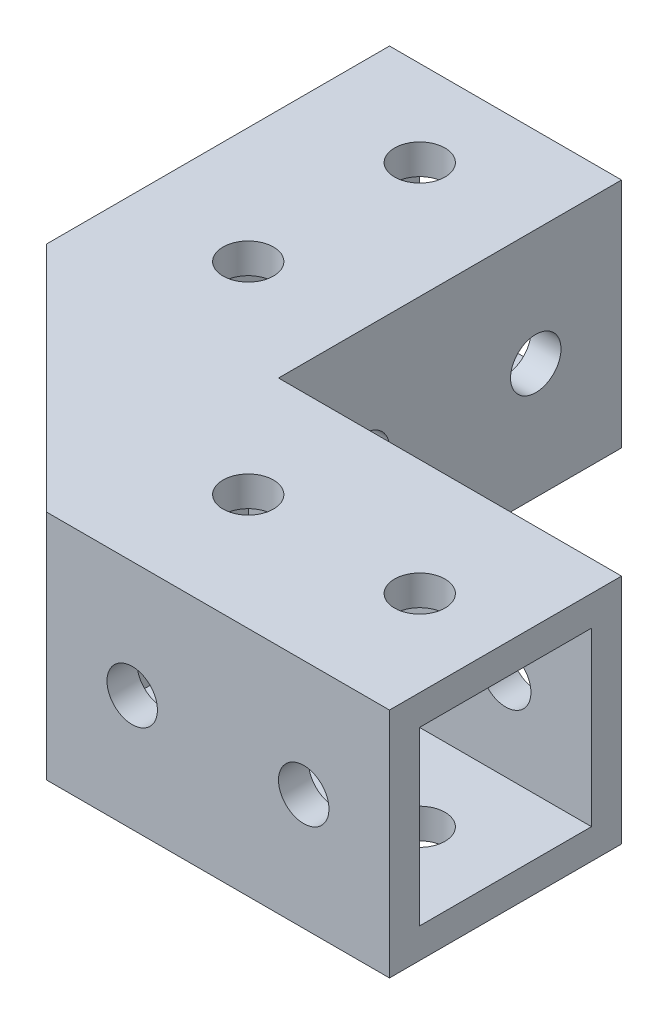
from build123d import *

# Parameters (mm, degrees)
SKETCH1_W           = 34
SKETCH1_H           = 23
SKETCH1_R           = 2.5
BOSS_EXTRUDE1_DEPTH = 23
SKETCH6_OUTSIDE_W   = 45.41
SKETCH6_OUTSIDE_H   = 34.41
SKETCH6_OUTSIDE_W_2 = 34
SKETCH6_OUTSIDE_H_2 = 23
SKETCH6_OUTSIDE_R   = 2.5
CUT_EXTRUDE10_DEPTH = 48.053161424
SKETCH7_OUTSIDE_W   = 34.41
SKETCH7_OUTSIDE_H   = 34.41
SKETCH7_OUTSIDE_W_2 = 23
SKETCH7_OUTSIDE_H_2 = 23
SKETCH7_OUTSIDE_W_3 = 17.04
SKETCH7_OUTSIDE_H_3 = 17.04
CUT_EXTRUDE11_DEPTH = 34
BOSS_EXTRUDE2_DEPTH = 23
SKETCH13_R          = 2.5
BOSS_EXTRUDE3_DEPTH = 4


with BuildPart() as part:
    # sketch1 → Boss-Extrude1 (new body)
    with BuildSketch(Plane(origin=(0, 0, 0), x_dir=(1, 0, 0), z_dir=(0, 1, 0))):
        with Locations((17, -11.5)):
            Rectangle(SKETCH1_W, SKETCH1_H)
        with Locations((8.5, -11.5)):
            Circle(SKETCH1_R, mode=Mode.SUBTRACT)
        with Locations((25.5, -11.5)):
            Circle(SKETCH1_R, mode=Mode.SUBTRACT)
    extrude(amount=BOSS_EXTRUDE1_DEPTH)

    # Sketch6 outside → Cut-Extrude10 (cut, through all)
    # profile 1 of 3: a face of its own
    with BuildSketch(Plane(origin=(0, 0, 0), x_dir=(-1, 0, 0), z_dir=(0, 0, -1))):
        with Locations((-17, 11.5)):
            Rectangle(SKETCH6_OUTSIDE_W, SKETCH6_OUTSIDE_H)
        with Locations((-17, 11.5)):
            Rectangle(SKETCH6_OUTSIDE_W_2, SKETCH6_OUTSIDE_H_2, mode=Mode.SUBTRACT)
    # profile 2 of 3: a face of its own
    with BuildSketch(Plane(origin=(0, 0, 0), x_dir=(-1, 0, 0), z_dir=(0, 0, -1))):
        with Locations((-25.5, 11.5)):
            Circle(SKETCH6_OUTSIDE_R)
    # profile 3 of 3: a face of its own
    with BuildSketch(Plane(origin=(0, 0, 0), x_dir=(-1, 0, 0), z_dir=(0, 0, -1))):
        with Locations((-8.5, 11.5)):
            Circle(SKETCH6_OUTSIDE_R)
    extrude(amount=-CUT_EXTRUDE10_DEPTH, mode=Mode.SUBTRACT)

    # Sketch7 outside → Cut-Extrude11 (cut)
    # profile 1 of 2: a face of its own
    with BuildSketch(Plane(origin=(34, 0, 0), x_dir=(0, 0, -1), z_dir=(1, 0, 0))):
        with Locations((-11.5, 11.5)):
            Rectangle(SKETCH7_OUTSIDE_W, SKETCH7_OUTSIDE_H)
        with Locations((-11.5, 11.5)):
            Rectangle(SKETCH7_OUTSIDE_W_2, SKETCH7_OUTSIDE_H_2, mode=Mode.SUBTRACT)
    # profile 2 of 2: a face of its own
    with BuildSketch(Plane(origin=(34, 0, 0), x_dir=(0, 0, -1), z_dir=(1, 0, 0))):
        with Locations((-11.5, 11.5)):
            Rectangle(SKETCH7_OUTSIDE_W_3, SKETCH7_OUTSIDE_H_3)
    extrude(amount=-CUT_EXTRUDE11_DEPTH, mode=Mode.SUBTRACT)


with BuildPart() as body_2:
    # Mirror6: mirrored copy
    add(part.part.mirror(Plane(origin=(0, 0, 0), x_dir=(-0.7071067811865462, 0, 0.7071067811865489), z_dir=(-0.707106781186549, 0, -0.7071067811865461))))


with BuildPart() as part_1:
    add(part.part)

    add(body_2.part)  # Boss-Extrude2 merges body 2
    # Sketch11 → Boss-Extrude2 (add)
    with BuildSketch(Plane(origin=(0, 0, 0), x_dir=(1, 0, 0), z_dir=(0, 1, 0))):
        Polygon((-23, 0), (0, -23), (0, 0), align=None)
    extrude(amount=BOSS_EXTRUDE2_DEPTH)

    # Sketch13 → Boss-Extrude3 (add)
    with BuildSketch(Plane(origin=(0, 0, 0), x_dir=(1, 0, 0), z_dir=(0, 1, 0))):
        Polygon((8.706365938, 8.706365938), (0, 17), (0, 0), (17, 0), align=None)
        with Locations((5.170832032, 5.170832032)):
            Circle(SKETCH13_R, mode=Mode.SUBTRACT)
    extrude(amount=BOSS_EXTRUDE3_DEPTH)


solid = part_1.part
